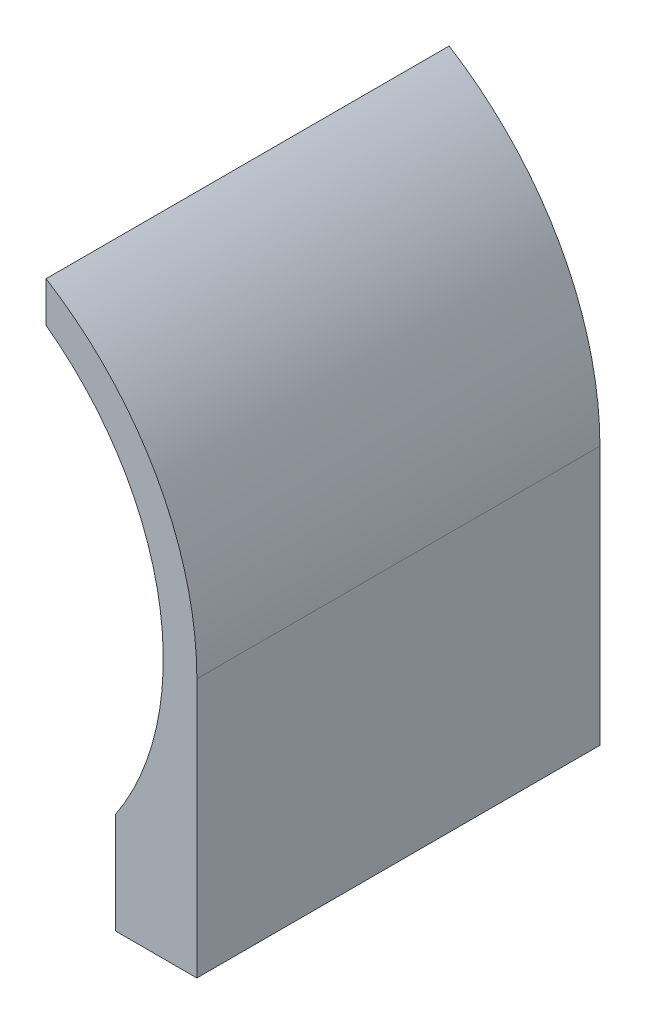
from build123d import *

# Parameters (mm, degrees)
INNER_RING_RIGHT_SIDE_DEPTH = 120


with BuildPart() as part:
    # Sketch2 → Inner Ring - Right Side (new body)
    with BuildSketch(Plane.XY):
        with BuildLine():
            Line((70.731226598, -47.139087644), (70.731226598, -77.139087644))
            Line((70.731226598, -77.139087644), (95, -77.139087644))
            Line((95, -77.139087644), (95, 0))
            ThreePointArc((95, 0), (83.019576005, 46.181706335), (50.1, 80.715487981))
            Line((50.1, 80.715487981), (50.1, 68.665784784))
            ThreePointArc((50.1, 68.665784784), (83.682366421, 14.908438891), (70.731226598, -47.139087644))
        make_face()
    extrude(amount=INNER_RING_RIGHT_SIDE_DEPTH)


solid = part.part
